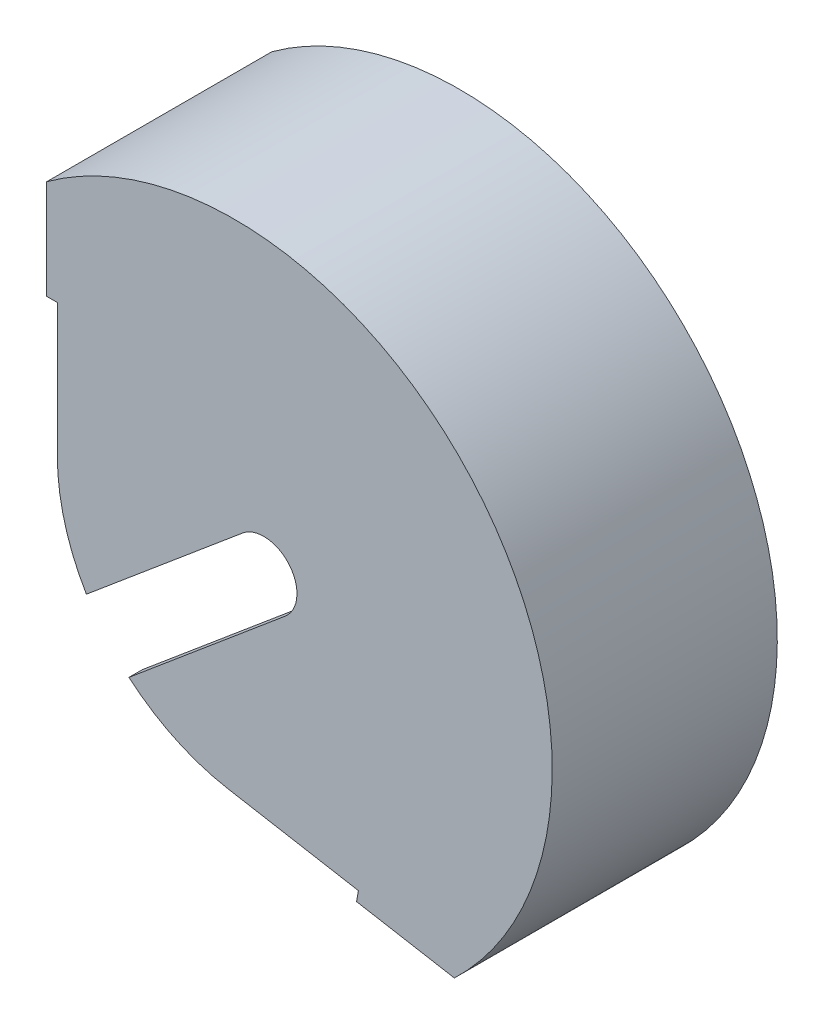
from build123d import *

# Parameters (mm, degrees)
BOSS_EXTRUDE1_DEPTH = 2.54
BOSS_EXTRUDE2_DEPTH = 38.1
CUT_EXTRUDE1_REACH  = 91.919


with BuildPart() as part:
    # Sketch1 → Boss-Extrude1 (new body)
    with BuildSketch(Plane.XY):
        with BuildLine():
            ThreePointArc((-39.624, 0), (-30.353745014, -25.469816246), (-6.880635392, -39.022022405))
            Line((-6.880635392, -39.022022405), (18.133481535, -43.432686118))
            Line((18.133481535, -43.432686118), (17.780628438, -45.433815472))
            Line((17.780628438, -45.433815472), (36.541216132, -48.741813257))
            ThreePointArc((36.541216132, -48.741813257), (41.053420058, 34.447909629), (-41.656, 44.45))
            Line((-41.656, 44.45), (-41.656, 25.4))
            Line((-41.656, 25.4), (-39.624, 25.4))
            Line((-39.624, 25.4), (-39.624, 0))
        make_face()
    boss_extrude1 = extrude(amount=BOSS_EXTRUDE1_DEPTH)

    # Sketch2 → Boss-Extrude2 (add)
    with BuildSketch(Plane.XY.offset(2.54)):
        with BuildLine():
            Line((-41.656, 42.400565706), (-40.15552705, 42.400565706))
            ThreePointArc((-40.15552705, 42.400565706), (39.107667173, 32.815229101), (34.783471744, -46.908255332))
            Line((34.783471744, -46.908255332), (34.52291735, -48.385932726))
            Line((34.52291735, -48.385932726), (36.541216132, -48.741813257))
            ThreePointArc((36.541216132, -48.741813257), (41.053420058, 34.447909629), (-41.656, 44.45))
            Line((-41.656, 44.45), (-41.656, 42.400565706))
        make_face()
    extrude(amount=BOSS_EXTRUDE2_DEPTH)

    # Mirror1: Boss-Extrude1 across plane
    add(boss_extrude1.mirror(Plane.XY.offset(21.59)))

    # Sketch3 → Cut-Extrude1 (cut, up to next)
    with BuildSketch(Plane.XY.offset(43.18), mode=Mode.PRIVATE) as cut_extrude1_sk1:
        with BuildLine():
            Line((-4.081701322, 4.864382214), (-37.159500375, -22.891186772))
            Line((-37.159500375, -22.891186772), (-28.996097732, -32.6199512))
            Line((-28.996097732, -32.6199512), (4.081701322, -4.864382214))
            ThreePointArc((4.081701322, -4.864382214), (4.864382214, 4.081701322), (-4.081701322, 4.864382214))
        make_face()
    cut_extrude1_tool1 = extrude(cut_extrude1_sk1.sketch, amount=-CUT_EXTRUDE1_REACH, mode=Mode.PRIVATE) & part.part
    add(cut_extrude1_tool1.solids().sort_by_distance((-14.612688, -12.261501, 43.18))[0], mode=Mode.SUBTRACT)


solid = part.part
